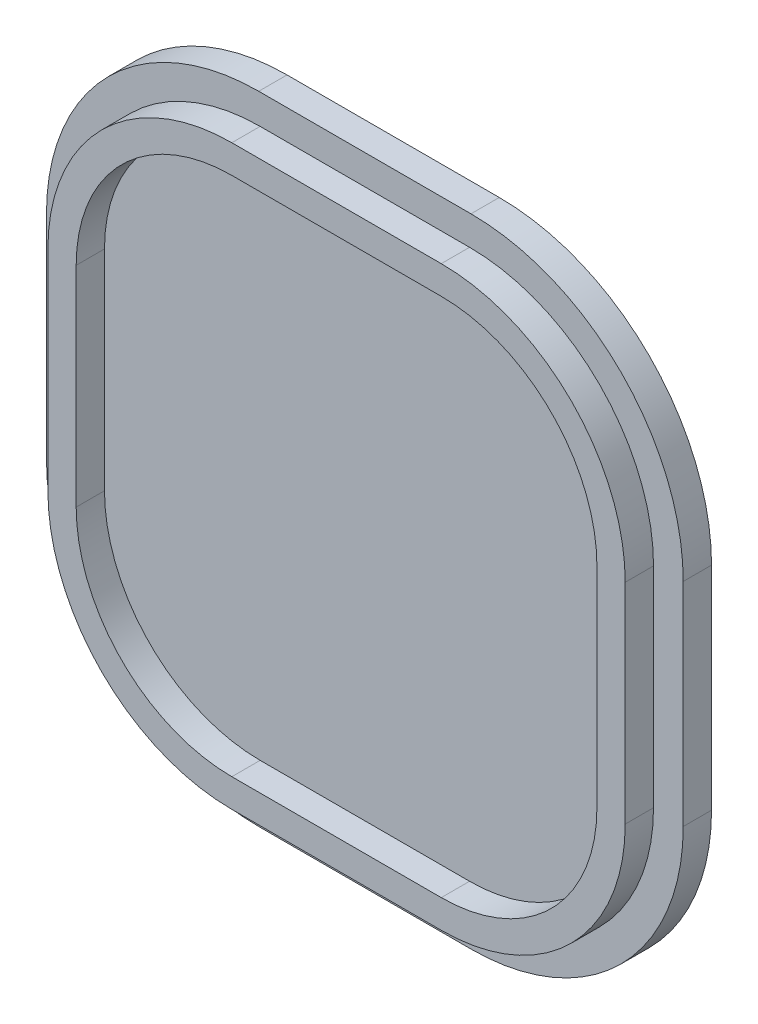
from build123d import *

# Parameters (mm, degrees)
SKETCH_1_W      = 45
SKETCH_1_H      = 45
EXTRUDE_1_DEPTH = 2
FILLET_1_R      = 15
SKETCH_2_W      = 40.8
SKETCH_2_H      = 40.8
EXTRUDE_2_DEPTH = 2
FILLET_2_R      = 13
SHELL_1_T       = -2


with BuildPart() as part:
    # 스케치1 → 보스-돌출1 (new body)
    with BuildSketch(Plane.XY):
        with Locations((11.279766248, -4.096820809)):
            Rectangle(SKETCH_1_W, SKETCH_1_H)
    extrude(amount=EXTRUDE_1_DEPTH)

    # 필렛1
    fillet_1_edges = [part.edges().sort_by_distance(p)[0] for p in [
        (-11.220233752, 18.403179191, 1),
        (33.779766248, 18.403179191, 1),
        (33.779766248, -26.596820809, 1),
        (-11.220233752, -26.596820809, 1),
    ]]
    fillet(fillet_1_edges, radius=FILLET_1_R)

    # 스케치2 → 보스-돌출2 (add)
    with BuildSketch(Plane.XY.offset(2)):
        with Locations((11.279766248, -4.096820809)):
            Rectangle(SKETCH_2_W, SKETCH_2_H)
    extrude(amount=EXTRUDE_2_DEPTH)

    # 필렛2
    # the kernel refuses this fillet: 13 mm, written as the material it takes off along each edge
    with BuildSketch(Plane(origin=(31.679766248, -24.496820809, 2), x_dir=(0, 1, 0), z_dir=(0, 0, 1)), Plane(origin=(31.679766248, 16.303179191, 2), x_dir=(-1, 0, 0), z_dir=(0, 0, 1))) as fillet_2_piece_1:
        with BuildLine():
            CenterArc((FILLET_2_R, FILLET_2_R), FILLET_2_R, 180, 90)
            Line((0, FILLET_2_R), (0, 0))
            Line((0, 0), (FILLET_2_R, 0))
        make_face()
    extrude(amount=34.5, mode=Mode.SUBTRACT)
    with BuildSketch(Plane(origin=(-9.120233752, 16.303179191, 2), x_dir=(1, 0, 0), z_dir=(0, 0, 1)), Plane(origin=(-9.120233752, -24.496820809, 2), x_dir=(0, 1, 0), z_dir=(0, 0, 1))) as fillet_2_piece_2:
        with BuildLine():
            CenterArc((FILLET_2_R, -FILLET_2_R), FILLET_2_R, 90, 90)
            Line((0, -FILLET_2_R), (0, 0))
            Line((0, 0), (FILLET_2_R, 0))
        make_face()
    extrude(amount=34.5, mode=Mode.SUBTRACT)

    # 쉘1
    shell_1_openings = [part.faces().sort_by_distance(p)[0] for p in [
        (11.279766248, -4.096820809, 4),
    ]]
    offset(amount=SHELL_1_T, openings=shell_1_openings, kind=Kind.INTERSECTION)


solid = part.part
